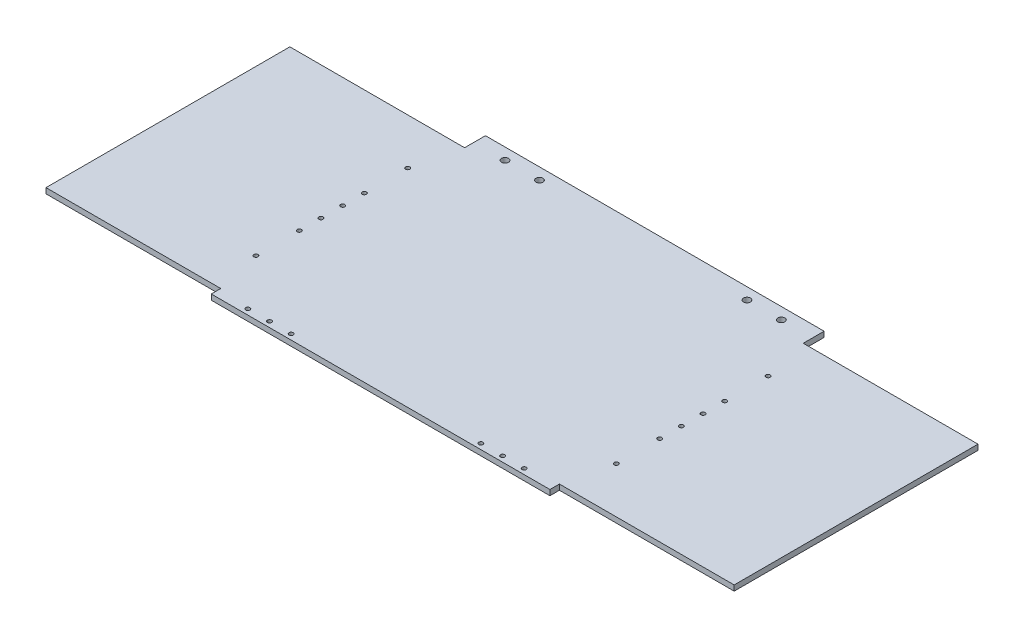
from build123d import *

# Parameters (mm, degrees)
SKETCH1_R           = 2.564
SKETCH1_R_2         = 1.55
BOSS_EXTRUDE1_DEPTH = 4


with BuildPart() as part:
    # Sketch1 → Boss-Extrude1 (new body)
    with BuildSketch(Plane(origin=(0, 0, 0), x_dir=(1, 0, 0), z_dir=(0, 1, 0))):
        Polygon((129, 0), (129, -7), (379, -7), (379, 0), (508, 0), (508, 180), (379, 180), (379, 195.398), (129, 195.398), (129, 180), (0, 180), (0, 0), align=None)
        with Locations((152, 186.858)):
            Circle(SKETCH1_R, mode=Mode.SUBTRACT)
        with Locations((177.4, 186.858)):
            Circle(SKETCH1_R, mode=Mode.SUBTRACT)
        with Locations((152, -3)):
            Circle(SKETCH1_R_2, mode=Mode.SUBTRACT)
        with Locations((184, -3)):
            Circle(SKETCH1_R_2, mode=Mode.SUBTRACT)
        with Locations((330.6, 186.858)):
            Circle(SKETCH1_R, mode=Mode.SUBTRACT)
        with Locations((356, 186.858)):
            Circle(SKETCH1_R, mode=Mode.SUBTRACT)
        with Locations((168, -3)):
            Circle(SKETCH1_R_2, mode=Mode.SUBTRACT)
        with Locations((324, -3)):
            Circle(SKETCH1_R_2, mode=Mode.SUBTRACT)
        with Locations((340, -3)):
            Circle(SKETCH1_R_2, mode=Mode.SUBTRACT)
        with Locations((356, -3)):
            Circle(SKETCH1_R_2, mode=Mode.SUBTRACT)
        with Locations((121, 146)):
            Circle(SKETCH1_R_2, mode=Mode.SUBTRACT)
        with Locations((121, 114)):
            Circle(SKETCH1_R_2, mode=Mode.SUBTRACT)
        with Locations((121, 98)):
            Circle(SKETCH1_R_2, mode=Mode.SUBTRACT)
        with Locations((121, 82)):
            Circle(SKETCH1_R_2, mode=Mode.SUBTRACT)
        with Locations((121, 66)):
            Circle(SKETCH1_R_2, mode=Mode.SUBTRACT)
        with Locations((121, 34)):
            Circle(SKETCH1_R_2, mode=Mode.SUBTRACT)
        with Locations((387, 146)):
            Circle(SKETCH1_R_2, mode=Mode.SUBTRACT)
        with Locations((387, 114)):
            Circle(SKETCH1_R_2, mode=Mode.SUBTRACT)
        with Locations((387, 98)):
            Circle(SKETCH1_R_2, mode=Mode.SUBTRACT)
        with Locations((387, 82)):
            Circle(SKETCH1_R_2, mode=Mode.SUBTRACT)
        with Locations((387, 66)):
            Circle(SKETCH1_R_2, mode=Mode.SUBTRACT)
        with Locations((387, 34)):
            Circle(SKETCH1_R_2, mode=Mode.SUBTRACT)
    extrude(amount=BOSS_EXTRUDE1_DEPTH)


solid = part.part
